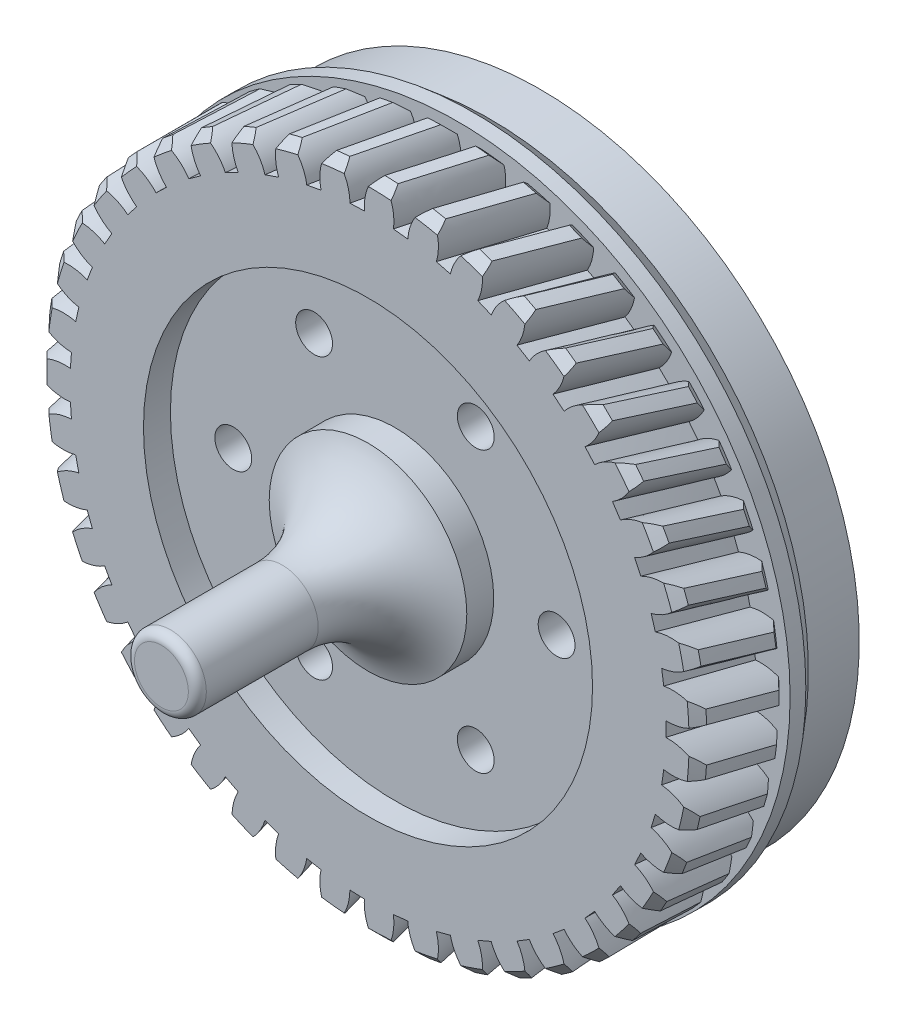
from build123d import *

# Parameters (mm, degrees)
SKETCH5_R              = 36.75
BOSS_EXTRUDE1_DEPTH    = 10
CHAMFER1_SIZE          = 1
CUT_SWEEP1_PITCH       = 869.565217391
CUT_SWEEP1_HEIGHT      = 20
CUT_SWEEP1_RADIUS      = 36.75
CUT_SWEEP1_START_ANGLE = 180
CIRPATTERN1_COUNT      = 43
BOSS_EXTRUDE2_START    = 10
SKETCH12_R             = 4
BOSS_EXTRUDE2_DEPTH    = 23
CUT_EXTRUDE2_START     = 10
SKETCH13_R             = 25
SKETCH13_R_2           = 11
CUT_EXTRUDE2_DEPTH     = 3
FILLET1_R              = 1
FILLET2_R              = 10
CUT_EXTRUDE3_START     = 7
SKETCH14_R             = 2.05
CUT_EXTRUDE3_DEPTH     = 20


with BuildPart() as part:
    # Sketch5 → Boss-Extrude1 (new body)
    with BuildSketch(Plane(origin=(0, 0, 0), x_dir=(0, 1, 0), z_dir=(0, 0, 1))):
        with Locations(Location((0, 0, 0), (0, 0, 270))):
            Circle(SKETCH5_R)
    extrude(amount=BOSS_EXTRUDE1_DEPTH)

    # Chamfer1
    chamfer1_edges = [part.edges().sort_by_distance(p)[0] for p in [
        (-36.75, 0, 0),
        (-36.75, 0, 10),
    ]]
    chamfer(chamfer1_edges, length=CHAMFER1_SIZE)

    # Cut-Sweep1: sweep along a helix
    with BuildLine() as cut_sweep1_path:
        add(Helix(CUT_SWEEP1_PITCH, CUT_SWEEP1_HEIGHT, CUT_SWEEP1_RADIUS, center=(0, 0, 10), direction=(0, 0, -1), mode=Mode.PRIVATE).rotate(Axis((0, 0, 10), (0, 0, -1)), CUT_SWEEP1_START_ANGLE))
    # Sketch10 → Cut-Sweep1 (sweep, cut)
    with BuildSketch(Plane.XY.offset(10)):
        with BuildLine():
            Line((33.164480964, 0.8085), (33.164480964, -0.8085))
            ThreePointArc((33.164480964, -0.8085), (35.180183413, -1.115865105), (36.937480964, -2.15))
            ThreePointArc((36.937480964, -2.15), (37, 0), (36.937480964, 2.15))
            ThreePointArc((36.937480964, 2.15), (35.180183413, 1.115865105), (33.164480964, 0.8085))
        make_face()
    cut_sweep1 = sweep(path=cut_sweep1_path.line, is_frenet=True, mode=Mode.SUBTRACT)

    # CirPattern1: Cut-Sweep1 ×43 about axis
    cirpattern1_axis = Axis((0, 0, 10), (0, 0, -1))
    for i in range(1, CIRPATTERN1_COUNT):
        add(cut_sweep1.rotate(cirpattern1_axis, i * 360 / CIRPATTERN1_COUNT), mode=Mode.SUBTRACT)

    # Sketch12 → Boss-Extrude2 (add)
    with BuildSketch(Plane(origin=(0, 0, 0), x_dir=(0, 1, 0), z_dir=(0, 0, 1)).offset(BOSS_EXTRUDE2_START)):
        with Locations(Location((0, 0, 0), (0, 0, 270))):
            Circle(SKETCH12_R)
    extrude(amount=BOSS_EXTRUDE2_DEPTH)

    # Sketch13 → Cut-Extrude2 (cut)
    with BuildSketch(Plane(origin=(0, 0, 0), x_dir=(0, 1, 0), z_dir=(0, 0, 1)).offset(CUT_EXTRUDE2_START)):
        with Locations(Location((0, 0, 0), (0, 0, 270))):
            Circle(SKETCH13_R)
        with Locations(Location((0, 0, 0), (0, 0, 270))):
            Circle(SKETCH13_R_2, mode=Mode.SUBTRACT)
    extrude(amount=-CUT_EXTRUDE2_DEPTH, mode=Mode.SUBTRACT)

    # Fillet1
    fillet1_edges = [part.edges().sort_by_distance(p)[0] for p in [
        (-4, 0, 33),
    ]]
    fillet(fillet1_edges, radius=FILLET1_R)

    # Fillet2
    # the kernel refuses this fillet: 10 mm, written as the material it adds along each edge
    with BuildSketch(Plane(origin=(0, 0, 10), x_dir=(1, 0, 0), z_dir=(0, -1, 0))) as fillet2_piece_1:
        with BuildLine():
            CenterArc((14, 9.539392014), FILLET2_R, 180, 72.542396876)
            Line((11, 0), (10.94, -0.19078784))
            ThreePointArc((10.94, -0.19078784), (7.5, -0.2), (4, -0.2))
            Line((4, -0.2), (3.8, 0))
            Line((3.8, 0), (3.8, 9.539392014))
            Line((3.8, 9.539392014), (4, 9.539392014))
        make_face()
    revolve(axis=Axis((0, 0, 10), (0, 0, 1)))

    # Sketch17 → Revolve1 (revolve)
    with BuildSketch(Plane(origin=(0, 0, 0), x_dir=(-1, 0, 0), z_dir=(0, 1, 0)), mode=Mode.PRIVATE) as revolve1_sk:
        Polygon((-35.5, -9.2), (0, -9.2), (0, 0), (-37, 0), (-37, -1.75), (-35.5, -3.537630389), align=None)
    revolve(revolve1_sk.sketch.rotate(Axis((0, 0, -9.2), (0, 0, 1)), 180), axis=Axis((0, 0, -9.2), (0, 0, 1)))

    # Sketch14 → Cut-Extrude3 (cut)
    with BuildSketch(Plane(origin=(0, 0, 0), x_dir=(0, 1, 0), z_dir=(0, 0, 1)).offset(CUT_EXTRUDE3_START)):
        with Locations(Location((15.588457268, 9, 0), (0, 0, 270))):
            Circle(SKETCH14_R)
        with Locations(Location((15.588457268, -9, 0), (0, 0, 270))):
            Circle(SKETCH14_R)
        with Locations(Location((0, -18, 0), (0, 0, 270))):
            Circle(SKETCH14_R)
        with Locations(Location((-15.588457268, -9, 0), (0, 0, 270))):
            Circle(SKETCH14_R)
        with Locations(Location((-15.588457268, 9, 0), (0, 0, 270))):
            Circle(SKETCH14_R)
        with Locations(Location((0, 18, 0), (0, 0, 270))):
            Circle(SKETCH14_R)
    extrude(amount=-CUT_EXTRUDE3_DEPTH, mode=Mode.SUBTRACT)


solid = part.part
